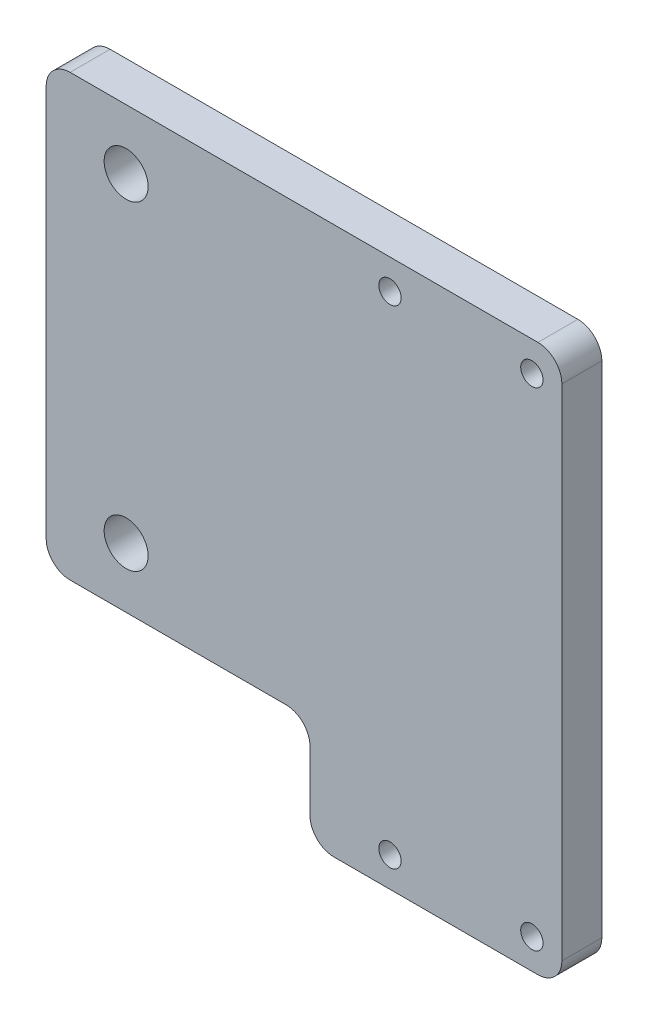
from build123d import *

# Parameters (mm, degrees)
MAIN_DEPTH            = 5
GEAR_AXIS_HOLES_D     = 5.5
FILLET1_R             = 3
F_3_CLEARANCE_HOLE1_D = 2.794


with BuildPart() as part:
    # Base → Main (new body)
    with BuildSketch(Plane.XY):
        Polygon((0, 27.5), (-33, 27.5), (-33, -27.5), (0, -27.5), (0, -40.995), (24, -40.995), (31.5, -40.995), (31.5, 27.5), (24, 27.5), align=None)
    extrude(amount=MAIN_DEPTH)

    # Gear Axis Holes (through all)
    with Locations(Plane(origin=(0, 0, 0), x_dir=(-1, 0, 0), z_dir=(0, 0, -1))):
        with Locations((23, -20), (23, 20)):
            Hole(GEAR_AXIS_HOLES_D / 2)

    # Fillet1
    fillet1_edges = [part.edges().sort_by_distance(p)[0] for p in [
        (0, -40.995, 2.5),
        (0, -27.5, 2.5),
        (-33, -27.5, 2.5),
        (-33, 27.5, 2.5),
        (31.5, 27.5, 2.5),
        (31.5, -40.995, 2.5),
    ]]
    fillet(fillet1_edges, radius=FILLET1_R)

    # #3 Clearance Hole1 (through all)
    with Locations(Plane.XY.offset(5)):
        with Locations((10, 23.75), (27.75, 23.75), (27.75, -37.245), (10, -37.245)):
            Hole(F_3_CLEARANCE_HOLE1_D / 2)


solid = part.part
